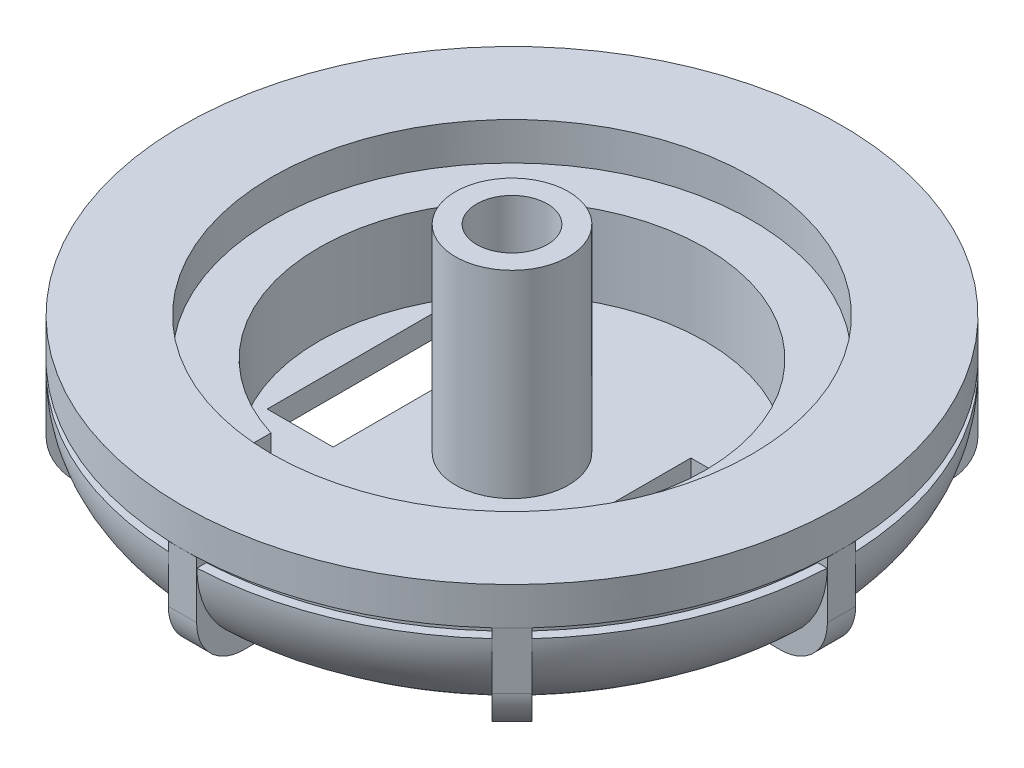
from build123d import *

# Parameters (mm, degrees)
SKETCH1_R               = 35
BOSS_EXTRUDE1_DEPTH     = 15
FILLET1_R               = 10
SKETCH2_W               = 1
SKETCH2_H               = 1
BOSS_EXTRUDE2_DEPTH     = 1.5
CIRPATTERN1_COUNT       = 8
SKETCH5_R               = 6
BOSS_EXTRUDE4_DEPTH     = 21
SKETCH6_R               = 25.5
SKETCH6_R_2             = 20.5
BOSS_EXTRUDE5_DEPTH     = 8.6
CUT_EXTRUDE1_DEPTH      = 54.768020365
CUT_EXTRUDE1_DEPTH_BACK = 54.768020365
SKETCH7_W               = 7
SKETCH7_H               = 18
CUT_EXTRUDE2_DEPTH      = 55.74997734
CUT_EXTRUDE2_DEPTH_BACK = 55.74997734
SKETCH8_R               = 3.75


# Read off the part's stored shape, not the designer's step: Shell1, Boss-Extrude3
with BuildPart() as part:
    # Sketch1 → Boss-Extrude1 (new body)
    with BuildSketch(Plane(origin=(0, 0, 0), x_dir=(1, 0, 0), z_dir=(0, 1, 0))):
        with Locations(Location((0, 0, 0), (0, 0, 270))):
            Circle(SKETCH1_R)
    extrude(amount=BOSS_EXTRUDE1_DEPTH)

    # Fillet1
    fillet1_edges = [part.edges().sort_by_distance(p)[0] for p in [
        (0, 0, -35),
    ]]
    fillet(fillet1_edges, radius=FILLET1_R)

    # Cut-Sweep1: sweep along a curve in space
    with BuildLine() as cut_sweep1_path:
        ThreePointArc((0, 10, 35), (24.748737342, 10, 24.748737342), (35, 10, 0))
        ThreePointArc((35, 10, 0), (24.748737342, 10, -24.748737342), (0, 10, -35))
        ThreePointArc((0, 10, -35), (-24.748737342, 10, -24.748737342), (-35, 10, 0))
        ThreePointArc((-35, 10, 0), (-24.748737342, 10, 24.748737342), (0, 10, 35))
    # Sketch2 → Cut-Sweep1 (sweep, cut)
    with BuildSketch(Plane.XY):
        with Locations((-34.5, 10.5)):
            Rectangle(SKETCH2_W, SKETCH2_H)
    sweep(path=cut_sweep1_path.line, mode=Mode.SUBTRACT)

    # Sketch3 → Boss-Extrude2 (add, symmetric)
    with BuildSketch(Plane.XY):
        with BuildLine():
            Line((-35, 11), (0, 11))
            Line((0, 11), (0, 0))
            Line((0, 0), (-30, 0))
            ThreePointArc((-30, 0), (-33.535533906, 1.464466094), (-35, 5))
            Line((-35, 5), (-35, 11))
        make_face()
    boss_extrude2 = extrude(amount=BOSS_EXTRUDE2_DEPTH, both=True)

    # CirPattern1: Boss-Extrude2 ×8 about axis
    cirpattern1_axis = Axis((0, 0, 0), (0, 1, 0))
    for i in range(1, CIRPATTERN1_COUNT):
        add(boss_extrude2.rotate(cirpattern1_axis, i * 360 / CIRPATTERN1_COUNT))

    # Shell1 outline → Shell1 (revolve, cut)
    with BuildSketch(Plane.XY):
        with BuildLine():
            Line((32.6, 15), (0, 15))
            Line((0, 15), (0, 2.4))
            Line((0, 2.4), (25, 2.4))
            ThreePointArc((25, 2.4), (29.445222154, 3.835585997), (32.211102551, 7.6))
            Line((32.211102551, 7.6), (31.6, 7.6))
            Line((31.6, 7.6), (31.6, 13.4))
            Line((31.6, 13.4), (32.6, 13.4))
            Line((32.6, 13.4), (32.6, 15))
        make_face()
    revolve(axis=Axis((0, 0, 0), (0, 1, 0)), mode=Mode.SUBTRACT)

    # Boss-Extrude3 outline → Boss-Extrude3 (revolve)
    with BuildSketch(Plane.XY):
        with BuildLine():
            Line((25.5, 15), (25.5, 2.416465204))
            ThreePointArc((25.5, 2.416465204), (29.64570058, 3.985229338), (32.211102551, 7.6))
            Line((32.211102551, 7.6), (31.6, 7.6))
            Line((31.6, 7.6), (31.6, 13.4))
            Line((31.6, 13.4), (32.6, 13.4))
            Line((32.6, 13.4), (32.6, 15))
            Line((32.6, 15), (25.5, 15))
        make_face()
    revolve(axis=Axis((0, 0, 0), (0, 1, 0)))

    # Sketch5 → Boss-Extrude4 (add)
    with BuildSketch(Plane(origin=(0, 2.4, 0), x_dir=(1, 0, 0), z_dir=(0, 1, 0))):
        with Locations(Location((0, 0, 0), (0, 0, 90))):
            Circle(SKETCH5_R)
    extrude(amount=BOSS_EXTRUDE4_DEPTH)

    # Sketch6 → Boss-Extrude5 (add)
    with BuildSketch(Plane(origin=(0, 2.4, 0), x_dir=(1, 0, 0), z_dir=(0, 1, 0))):
        with Locations(Location((0, 0, 0), (0, 0, 270))):
            Circle(SKETCH6_R)
        with Locations(Location((0, 0, 0), (0, 0, 270))):
            Circle(SKETCH6_R_2, mode=Mode.SUBTRACT)
    extrude(amount=BOSS_EXTRUDE5_DEPTH)

    # Sketch7 → Cut-Extrude1 (cut, two sides: drawn at the far end of the back side and taken through both)
    with BuildSketch(Plane(origin=(0, 2.4, 0), x_dir=(1, 0, 0), z_dir=(0, 1, 0)).offset(-CUT_EXTRUDE1_DEPTH_BACK)):
        with Locations((13.5, 0)):
            Rectangle(SKETCH7_W, SKETCH7_H)
        with Locations((-13.5, 0)):
            Rectangle(SKETCH7_W, SKETCH7_H)
        with BuildLine():
            Line((6, -16.784067463), (-6, -16.784067463))
            Line((-6, -16.784067463), (-6, -24.784067463))
            ThreePointArc((-6, -24.784067463), (0, -25.5), (6, -24.784067463))
            Line((6, -24.784067463), (6, -16.784067463))
        make_face()
    extrude(amount=CUT_EXTRUDE1_DEPTH + CUT_EXTRUDE1_DEPTH_BACK, mode=Mode.SUBTRACT)

    # Sketch8 → Cut-Extrude2 (cut, two sides: drawn at the far end of the back side and taken through both)
    with BuildSketch(Plane(origin=(0, 23.4, 0), x_dir=(1, 0, 0), z_dir=(0, 1, 0)).offset(-CUT_EXTRUDE2_DEPTH_BACK)):
        with Locations(Location((0, 0, 0), (0, 0, 270))):
            Circle(SKETCH8_R)
    extrude(amount=CUT_EXTRUDE2_DEPTH + CUT_EXTRUDE2_DEPTH_BACK, mode=Mode.SUBTRACT)


solid = part.part
